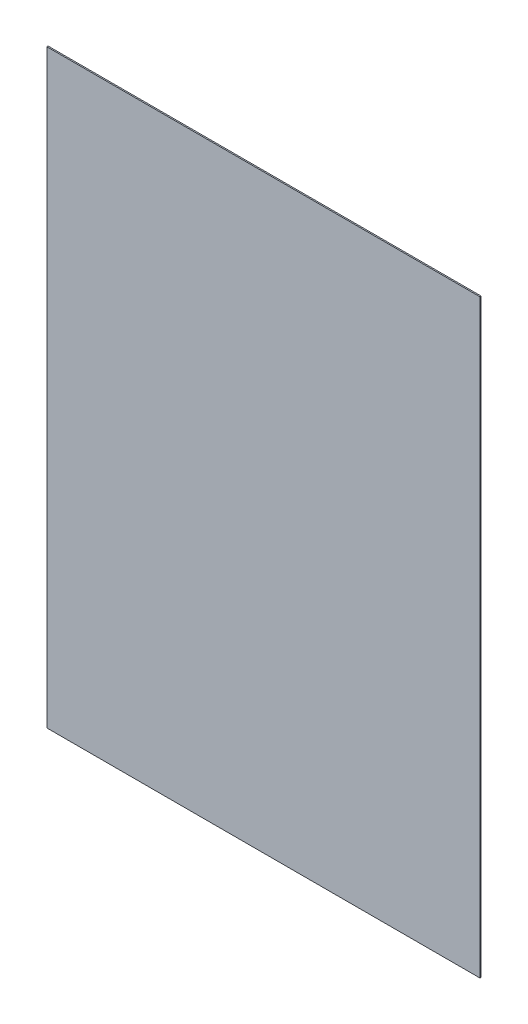
from build123d import *

# Parameters (mm, degrees)
SZKIC1_W               = 1380
SZKIC1_H               = 1880
ODGI_CIE_BAZOWE1_DEPTH = 4


# Sheet-metal steps are written as plain solids
with BuildPart() as part:
    # Szkic1 → Odgięcie bazowe1 (new body)
    with BuildSketch(Plane.XY):
        with Locations((690, 940)):
            Rectangle(SZKIC1_W, SZKIC1_H)
    extrude(amount=-ODGI_CIE_BAZOWE1_DEPTH)


solid = part.part
